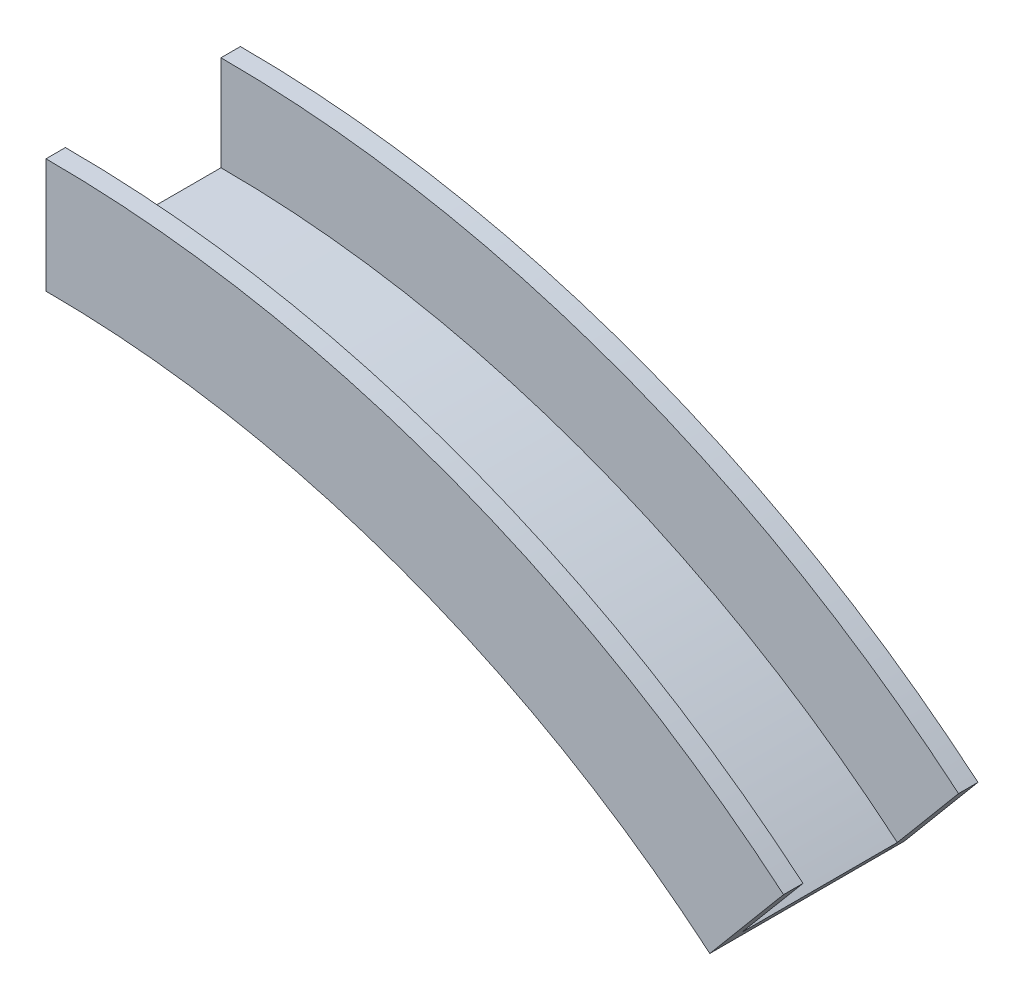
from build123d import *

# Parameters (mm, degrees)
STOCK_BEARINGHOLDER_1_ANGLE = 40


# Read off the part's stored shape, not the designer's step: Stock-BearingHolder-1
with BuildPart() as part:
    # Stock-BearingHolder-1 outline → Stock-BearingHolder-1 (revolve)
    with BuildSketch(Plane(origin=(0, 0, 0), x_dir=(0.6427876096865552, 0.7660444431189647, 0), z_dir=(0.7660444431189647, -0.6427876096865552, 0))):
        Polygon((168.656, 31.75), (168.656, 0), (187.3885, 0), (187.3885, 3.175), (171.831, 3.175), (171.831, 28.575), (187.3885, 28.575), (187.3885, 31.75), align=None)
    revolve(axis=Axis((0, 0, 0), (0, 0, 1)), revolution_arc=STOCK_BEARINGHOLDER_1_ANGLE)


with BuildPart() as body_2:
    # Split1: the piece on the far side of the plane
    add(part.part)
    split(bisect_by=Plane.XY.offset(3.175), keep=Keep.BOTTOM)


with BuildPart() as part_1:
    add(part.part)

    # Split1
    split(bisect_by=Plane.XY.offset(3.175), keep=Keep.TOP)


solid = Compound([body_2.part, part_1.part])
